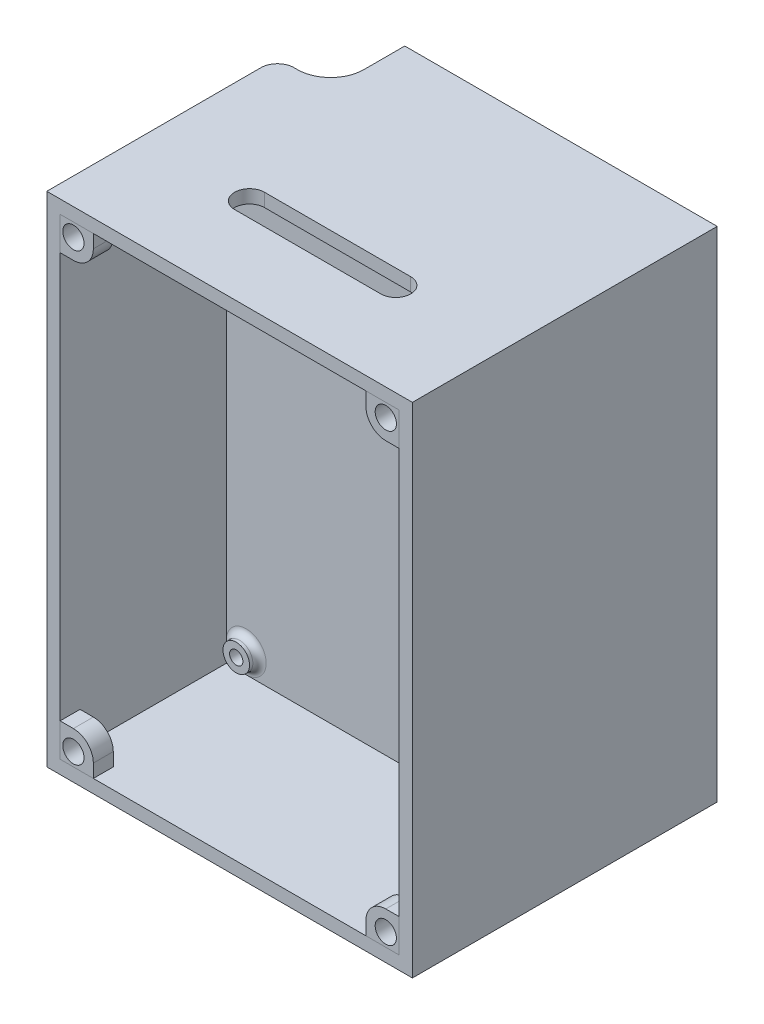
from build123d import *

# Parameters (mm, degrees)
SKETCH1_W             = 75
SKETCH1_H             = 55
BOSS_EXTRUDE1_DEPTH   = 3
SKETCH3_W             = 55
SKETCH3_H             = 75
SKETCH3_W_2           = 51
SKETCH3_H_2           = 71
BOSS_EXTRUDE2_DEPTH   = 25
BOSS_EXTRUDE4_DEPTH   = 3
BOSS_EXTRUDE4_2_DEPTH = 3
BOSS_EXTRUDE4_3_DEPTH = 3
BOSS_EXTRUDE4_4_DEPTH = 3
SKETCH5_R             = 1.6
CUT_EXTRUDE2_DEPTH    = 25
CUT_EXTRUDE4_DEPTH    = 2
BOSS_EXTRUDE6_DEPTH   = 75
SKETCH11_R            = 2.5
CUT_EXTRUDE5_DEPTH    = 1.7
SKETCH12_R            = 2
SKETCH12_R_2          = 1
BOSS_EXTRUDE8_DEPTH   = 1.5
FILLET2_R             = 1


with BuildPart() as part:
    # Sketch1 → Boss-Extrude1 (new body)
    with BuildSketch(Plane(origin=(0, 0, 0), x_dir=(0, 1, 0), z_dir=(0, 0, 1))):
        Rectangle(SKETCH1_W, SKETCH1_H)
    extrude(amount=BOSS_EXTRUDE1_DEPTH)

    # Cut-Extrude1 cone 1 section (through the dimple's axis) → Cut-Extrude1 (revolve, cut)
    with BuildSketch(Plane(origin=(-22.5, 32.5, 3), x_dir=(0, -1, 0), z_dir=(1, 0, 0))):
        Polygon((0, 0), (1, 0), (0, 11.430052303), align=None)
    revolve(axis=Axis((-22.5, 32.5, 3), (0, 0, -1)), mode=Mode.SUBTRACT)

    # Cut-Extrude1 cone 2 section (through the dimple's axis) → Cut-Extrude1 cone 2 (revolve, cut)
    with BuildSketch(Plane(origin=(22.5, 32.5, 3), x_dir=(0, -1, 0), z_dir=(1, 0, 0))):
        Polygon((0, 0), (1, 0), (0, 11.430052303), align=None)
    revolve(axis=Axis((22.5, 32.5, 3), (0, 0, -1)), mode=Mode.SUBTRACT)

    # Cut-Extrude1 cone 3 section (through the dimple's axis) → Cut-Extrude1 cone 3 (revolve, cut)
    with BuildSketch(Plane(origin=(-22.5, -32.5, 3), x_dir=(0, -1, 0), z_dir=(1, 0, 0))):
        Polygon((0, 0), (1, 0), (0, 11.430052303), align=None)
    revolve(axis=Axis((-22.5, -32.5, 3), (0, 0, -1)), mode=Mode.SUBTRACT)

    # Cut-Extrude1 cone 4 section (through the dimple's axis) → Cut-Extrude1 cone 4 (revolve, cut)
    with BuildSketch(Plane(origin=(22.5, -32.5, 3), x_dir=(0, -1, 0), z_dir=(1, 0, 0))):
        Polygon((0, 0), (1, 0), (0, 11.430052303), align=None)
    revolve(axis=Axis((22.5, -32.5, 3), (0, 0, -1)), mode=Mode.SUBTRACT)

    # Sketch3 → Boss-Extrude2 (add)
    with BuildSketch(Plane.XY.offset(3)):
        Rectangle(SKETCH3_W, SKETCH3_H)
        Rectangle(SKETCH3_W_2, SKETCH3_H_2, mode=Mode.SUBTRACT)
    extrude(amount=BOSS_EXTRUDE2_DEPTH)

    # Sketch8 → Cut-Extrude4 (cut)
    with BuildSketch(Plane(origin=(0, 37.5, 0), x_dir=(-1, 0, 0), z_dir=(0, 1, 0))):
        with BuildLine():
            Line((-11, 16.25), (11, 16.25))
            ThreePointArc((11, 16.25), (13.25, 14), (11, 11.75))
            Line((11, 11.75), (-11, 11.75))
            ThreePointArc((-11, 11.75), (-13.25, 14), (-11, 16.25))
        make_face()
    extrude(amount=-CUT_EXTRUDE4_DEPTH, mode=Mode.SUBTRACT)

    # Sketch10 → Boss-Extrude6 (add)
    with BuildSketch(Plane(origin=(0, 37.5, 0), x_dir=(-1, 0, 0), z_dir=(0, 1, 0))):
        with BuildLine():
            Line((-27.5, 0), (27.5, 0))
            Line((27.5, 0), (27.5, -4.204457527))
            ThreePointArc((27.5, -4.204457527), (26.767766953, -5.97222448), (25, -6.704457527))
            Line((25, -6.704457527), (24.5, -6.704457527))
            ThreePointArc((24.5, -6.704457527), (20.964466094, -8.168923621), (19.5, -11.704457527))
            Line((19.5, -11.704457527), (19.5, -17.854457527))
            Line((19.5, -17.854457527), (-27.5, -17.854457527))
            Line((-27.5, -17.854457527), (-27.5, 0))
        make_face()
    extrude(amount=-BOSS_EXTRUDE6_DEPTH)

    # Sketch11 → Cut-Extrude5 (cut)
    with BuildSketch(Plane(origin=(-19.5, 0, 0), x_dir=(0, -1, 0), z_dir=(-1, 0, 0))):
        with Locations(Location((-12.5, -14.779457527, 0), (0, 0, 90))):
            Circle(SKETCH11_R)
        with Locations(Location((12.5, -14.779457527, 0), (0, 0, 90))):
            Circle(SKETCH11_R)
    extrude(amount=-CUT_EXTRUDE5_DEPTH, mode=Mode.SUBTRACT)

    # Sketch12 → Boss-Extrude8 (add)
    # profile 1 of 4: a face of its own
    with BuildSketch(Plane.XY.offset(3)):
        with Locations(Location((22.5, -32.5, 0), (0, 0, 180))):
            Circle(SKETCH12_R)
        with Locations((22.5, -32.5)):
            Circle(SKETCH12_R_2, mode=Mode.SUBTRACT)
    # profile 2 of 4: a face of its own
    with BuildSketch(Plane.XY.offset(3)):
        with Locations(Location((22.5, 32.5, 0), (0, 0, 180))):
            Circle(SKETCH12_R)
        with Locations((22.5, 32.5)):
            Circle(SKETCH12_R_2, mode=Mode.SUBTRACT)
    # profile 3 of 4: a face of its own
    with BuildSketch(Plane.XY.offset(3)):
        with Locations(Location((-22.5, 32.5, 0), (0, 0, 180))):
            Circle(SKETCH12_R)
        with Locations((-22.5, 32.5)):
            Circle(SKETCH12_R_2, mode=Mode.SUBTRACT)
    # profile 4 of 4: a face of its own
    with BuildSketch(Plane.XY.offset(3)):
        with Locations(Location((-22.5, -32.5, 0), (0, 0, 180))):
            Circle(SKETCH12_R)
        with Locations((-22.5, -32.5)):
            Circle(SKETCH12_R_2, mode=Mode.SUBTRACT)
    extrude(amount=BOSS_EXTRUDE8_DEPTH)

    # Fillet2
    fillet2_edges = [part.edges().sort_by_distance(p)[0] for p in [
        (24.5, -32.5, 3),
        (24.5, 32.5, 3),
        (-20.5, 32.5, 3),
        (-20.5, -32.5, 3),
    ]]
    fillet(fillet2_edges, radius=FILLET2_R - 0.0001)  # a hair under: the kernel refuses the full size


with BuildPart() as body_2:
    # Sketch4 → Boss-Extrude4 (new body)
    with BuildSketch(Plane(origin=(0, 0, 28), x_dir=(0, -1, 0), z_dir=(0, 0, 1))):
        with BuildLine():
            Line((-35.5, 25.5), (-30.5, 25.5))
            Line((-30.5, 25.5), (-30.5, 23.5))
            ThreePointArc((-30.5, 23.5), (-31.378679656, 21.378679656), (-33.5, 20.5))
            Line((-33.5, 20.5), (-35.5, 20.5))
            Line((-35.5, 20.5), (-35.5, 25.5))
        make_face()
    extrude(amount=-BOSS_EXTRUDE4_DEPTH)


with BuildPart() as body_3:
    # Sketch4 → Boss-Extrude4 2 (new body)
    with BuildSketch(Plane(origin=(0, 0, 28), x_dir=(0, -1, 0), z_dir=(0, 0, 1))):
        with BuildLine():
            Line((35.5, 20.5), (33.5, 20.5))
            ThreePointArc((33.5, 20.5), (31.378679656, 21.378679656), (30.5, 23.5))
            Line((30.5, 23.5), (30.5, 25.5))
            Line((30.5, 25.5), (35.5, 25.5))
            Line((35.5, 25.5), (35.5, 20.5))
        make_face()
    extrude(amount=-BOSS_EXTRUDE4_2_DEPTH)


with BuildPart() as body_4:
    # Sketch4 → Boss-Extrude4 3 (new body)
    with BuildSketch(Plane(origin=(0, 0, 28), x_dir=(0, -1, 0), z_dir=(0, 0, 1))):
        with BuildLine():
            Line((35.5, -25.5), (35.5, -20.5))
            Line((35.5, -20.5), (33.5, -20.5))
            ThreePointArc((33.5, -20.5), (31.378679656, -21.378679656), (30.5, -23.5))
            Line((30.5, -23.5), (30.5, -25.5))
            Line((30.5, -25.5), (35.5, -25.5))
        make_face()
    extrude(amount=-BOSS_EXTRUDE4_3_DEPTH)


with BuildPart() as body_5:
    # Sketch4 → Boss-Extrude4 4 (new body)
    with BuildSketch(Plane(origin=(0, 0, 28), x_dir=(0, -1, 0), z_dir=(0, 0, 1))):
        with BuildLine():
            Line((-35.5, -20.5), (-33.5, -20.5))
            ThreePointArc((-33.5, -20.5), (-31.378679656, -21.378679656), (-30.5, -23.5))
            Line((-30.5, -23.5), (-30.5, -25.5))
            Line((-30.5, -25.5), (-35.5, -25.5))
            Line((-35.5, -25.5), (-35.5, -20.5))
        make_face()
    extrude(amount=-BOSS_EXTRUDE4_4_DEPTH)


with BuildPart() as cut_extrude2_tool:
    # Sketch5 → Cut-Extrude2 (new body)
    with BuildSketch(Plane(origin=(0, 0, 28), x_dir=(0, -1, 0), z_dir=(0, 0, 1))):
        with Locations(Location((-33.5, 23.5, 0), (0, 0, 90))):
            Circle(SKETCH5_R)
        with Locations(Location((-33.5, -23.5, 0), (0, 0, 90))):
            Circle(SKETCH5_R)
        with Locations(Location((33.5, -23.5, 0), (0, 0, 90))):
            Circle(SKETCH5_R)
        with Locations(Location((33.5, 23.5, 0), (0, 0, 90))):
            Circle(SKETCH5_R)
    extrude(amount=-CUT_EXTRUDE2_DEPTH)


with BuildPart() as body_2_1:
    add(body_2.part)

    # Cut-Extrude2: cut by cut_extrude2_tool
    add(cut_extrude2_tool.part, mode=Mode.SUBTRACT)


with BuildPart() as body_3_1:
    add(body_3.part)

    # Cut-Extrude2: cut by cut_extrude2_tool
    add(cut_extrude2_tool.part, mode=Mode.SUBTRACT)


with BuildPart() as body_4_1:
    add(body_4.part)

    # Cut-Extrude2: cut by cut_extrude2_tool
    add(cut_extrude2_tool.part, mode=Mode.SUBTRACT)


with BuildPart() as body_5_1:
    add(body_5.part)

    # Cut-Extrude2: cut by cut_extrude2_tool
    add(cut_extrude2_tool.part, mode=Mode.SUBTRACT)


solid = Compound([part.part, body_2_1.part, body_3_1.part, body_4_1.part, body_5_1.part])
